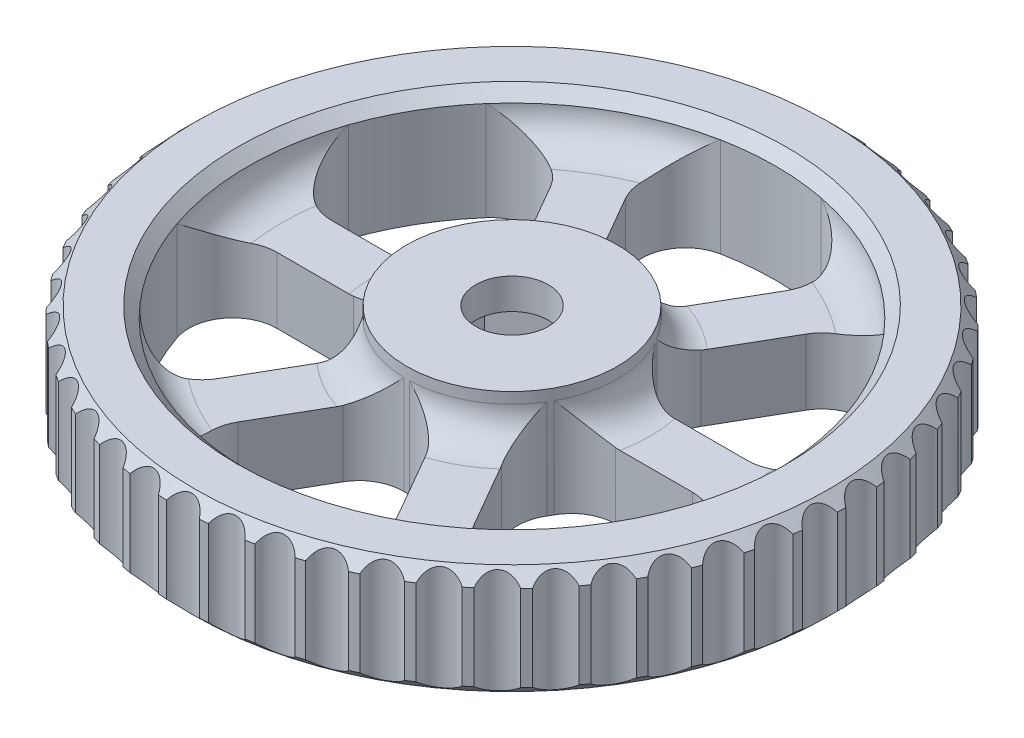
from build123d import *

# Parameters (mm, degrees)
SKETCH1_R           = 15
BOSS_EXTRUDE1_DEPTH = 5
CUT_EXTRUDE1_DEPTH  = 3.6
SKETCH3_R           = 1.65
CUT_EXTRUDE2_DEPTH  = 22.794494718
SKETCH6_R           = 12
SKETCH6_R_2         = 4.793642387
CUT_EXTRUDE5_DEPTH  = 2
CUT_EXTRUDE6_DEPTH  = 22.424285286
CUT_EXTRUDE7_DEPTH  = 22.794494718
FILLET1_START       = 3
FILLET1_DEPTH       = 1.5000001


with BuildPart() as part:
    # Sketch1 → Boss-Extrude1 (new body)
    with BuildSketch(Plane(origin=(0, 0, 0), x_dir=(1, 0, 0), z_dir=(0, 1, 0))):
        with Locations(Location((0, 0, 0), (0, 0, 270))):
            Circle(SKETCH1_R)
    extrude(amount=BOSS_EXTRUDE1_DEPTH)

    # Sketch2 → Cut-Extrude1 (cut)
    with BuildSketch(Plane.XZ):
        Polygon((2.95, 1.703183294), (0, 3.406366588), (-2.95, 1.703183294), (-2.95, -1.703183294), (0, -3.406366588), (2.95, -1.703183294), align=None)
    extrude(amount=-CUT_EXTRUDE1_DEPTH, mode=Mode.SUBTRACT)

    # Sketch3 → Cut-Extrude2 (cut, through all)
    with BuildSketch(Plane.XZ):
        with Locations(Location((0, 0, 0), (0, 0, 270))):
            Circle(SKETCH3_R)
    extrude(amount=-CUT_EXTRUDE2_DEPTH, mode=Mode.SUBTRACT)

    # Sketch6 → Cut-Extrude5 (cut)
    with BuildSketch(Plane(origin=(0, 5, 0), x_dir=(1, 0, 0), z_dir=(0, 1, 0))):
        with Locations(Location((0, 0, 0), (0, 0, 270))):
            Circle(SKETCH6_R)
        with Locations(Location((0, 0, 0), (0, 0, 270))):
            Circle(SKETCH6_R_2, mode=Mode.SUBTRACT)
    extrude(amount=-CUT_EXTRUDE5_DEPTH, mode=Mode.SUBTRACT)

    # Sketch8 → Cut-Extrude6 (cut, through all)
    with BuildSketch(Plane(origin=(0, 3, 0), x_dir=(1, 0, 0), z_dir=(0, 1, 0))):
        with BuildLine():
            Line((-4.06544463, 4.541556654), (-5.811101835, 7.565123625))
            ThreePointArc((-5.811101835, 7.565123625), (-7.350863082, 8.555858345), (-9.051783171, 7.878148351))
            ThreePointArc((-9.051783171, 7.878148351), (-10.392304845, 6), (-11.348568192, 3.9))
            ThreePointArc((-11.348568192, 3.9), (-11.085022219, 2.088104996), (-9.45714016, 1.25))
            Line((-9.45714016, 1.25), (-5.96582575, 1.25))
            ThreePointArc((-5.96582575, 1.25), (-4.944442808, 1.530471901), (-4.20952908, 2.293223115))
            ThreePointArc((-4.20952908, 2.293223115), (-4.151416084, 2.396821193), (-4.090754014, 2.498947564))
            ThreePointArc((-4.090754014, 2.498947564), (-3.797648949, 3.516777129), (-4.06544463, 4.541556654))
        make_face()
        with BuildLine():
            Line((-3.646038325, 8.815123625), (-1.90038112, 5.791556654))
            ThreePointArc((-1.90038112, 5.791556654), (-1.146793858, 5.047249029), (-0.118775066, 4.792170679))
            ThreePointArc((-0.118775066, 4.792170679), (0, 4.793642387), (0.118775066, 4.792170679))
            ThreePointArc((0.118775066, 4.792170679), (1.146793858, 5.047249029), (1.90038112, 5.791556654))
            Line((1.90038112, 5.791556654), (3.646038325, 8.815123625))
            ThreePointArc((3.646038325, 8.815123625), (3.734159137, 10.643963341), (2.296785021, 11.778148351))
            ThreePointArc((2.296785021, 11.778148351), (0, 12), (-2.296785021, 11.778148351))
            ThreePointArc((-2.296785021, 11.778148351), (-3.734159137, 10.643963341), (-3.646038325, 8.815123625))
        make_face()
        with BuildLine():
            Line((5.811101835, 7.565123625), (4.06544463, 4.541556654))
            ThreePointArc((4.06544463, 4.541556654), (3.797648949, 3.516777129), (4.090754014, 2.498947564))
            ThreePointArc((4.090754014, 2.498947564), (4.151416084, 2.396821193), (4.20952908, 2.293223115))
            ThreePointArc((4.20952908, 2.293223115), (4.944442808, 1.530471901), (5.96582575, 1.25))
            Line((5.96582575, 1.25), (9.45714016, 1.25))
            ThreePointArc((9.45714016, 1.25), (11.085022219, 2.088104996), (11.348568192, 3.9))
            ThreePointArc((11.348568192, 3.9), (10.392304845, 6), (9.051783171, 7.878148351))
            ThreePointArc((9.051783171, 7.878148351), (7.350863082, 8.555858345), (5.811101835, 7.565123625))
        make_face()
        with BuildLine():
            Line((9.45714016, -1.25), (5.96582575, -1.25))
            ThreePointArc((5.96582575, -1.25), (4.944442808, -1.530471901), (4.20952908, -2.293223115))
            ThreePointArc((4.20952908, -2.293223115), (4.151416084, -2.396821193), (4.090754014, -2.498947564))
            ThreePointArc((4.090754014, -2.498947564), (3.797648949, -3.516777129), (4.06544463, -4.541556654))
            Line((4.06544463, -4.541556654), (5.811101835, -7.565123625))
            ThreePointArc((5.811101835, -7.565123625), (7.350863082, -8.555858345), (9.051783171, -7.878148351))
            ThreePointArc((9.051783171, -7.878148351), (10.392304845, -6), (11.348568192, -3.9))
            ThreePointArc((11.348568192, -3.9), (11.085022219, -2.088104996), (9.45714016, -1.25))
        make_face()
        with BuildLine():
            Line((3.646038325, -8.815123625), (1.90038112, -5.791556654))
            ThreePointArc((1.90038112, -5.791556654), (1.146793858, -5.047249029), (0.118775066, -4.792170679))
            ThreePointArc((0.118775066, -4.792170679), (0, -4.793642387), (-0.118775066, -4.792170679))
            ThreePointArc((-0.118775066, -4.792170679), (-1.146793858, -5.047249029), (-1.90038112, -5.791556654))
            Line((-1.90038112, -5.791556654), (-3.646038325, -8.815123625))
            ThreePointArc((-3.646038325, -8.815123625), (-3.734159137, -10.643963341), (-2.296785021, -11.778148351))
            ThreePointArc((-2.296785021, -11.778148351), (0, -12), (2.296785021, -11.778148351))
            ThreePointArc((2.296785021, -11.778148351), (3.734159137, -10.643963341), (3.646038325, -8.815123625))
        make_face()
        with BuildLine():
            Line((-5.811101835, -7.565123625), (-4.06544463, -4.541556654))
            ThreePointArc((-4.06544463, -4.541556654), (-3.797648949, -3.516777129), (-4.090754014, -2.498947564))
            ThreePointArc((-4.090754014, -2.498947564), (-4.151416084, -2.396821193), (-4.20952908, -2.293223115))
            ThreePointArc((-4.20952908, -2.293223115), (-4.944442808, -1.530471901), (-5.96582575, -1.25))
            Line((-5.96582575, -1.25), (-9.45714016, -1.25))
            ThreePointArc((-9.45714016, -1.25), (-11.085022219, -2.088104996), (-11.348568192, -3.9))
            ThreePointArc((-11.348568192, -3.9), (-10.392304845, -6), (-9.051783171, -7.878148351))
            ThreePointArc((-9.051783171, -7.878148351), (-7.350863082, -8.555858345), (-5.811101835, -7.565123625))
        make_face()
    extrude(amount=-CUT_EXTRUDE6_DEPTH, mode=Mode.SUBTRACT)

    # Sketch4 → Cut-Extrude7 (cut, through all)
    with BuildSketch(Plane(origin=(0, 5, 0), x_dir=(1, 0, 0), z_dir=(0, 1, 0))):
        with BuildLine():
            ThreePointArc((-0.75, -14.981238267), (0, -14.563250232), (0.75, -14.981238267))
            ThreePointArc((0.75, -14.981238267), (0, -15), (-0.75, -14.981238267))
        make_face()
        with BuildLine():
            ThreePointArc((-2.621733061, -14.769106803), (-1.825259243, -14.448414655), (-1.133561009, -14.957106653))
            ThreePointArc((-1.133561009, -14.957106653), (-1.879998503, -14.88172052), (-2.621733061, -14.769106803))
        make_face()
        with BuildLine():
            ThreePointArc((-4.452119825, -14.324057702), (-3.621733057, -14.105718946), (-2.999245083, -14.697092533))
            ThreePointArc((-2.999245083, -14.697092533), (-3.730348307, -14.528747417), (-4.452119825, -14.324057702))
        make_face()
        with BuildLine():
            ThreePointArc((-6.212294, -13.653109655), (-5.361089977, -13.540567624), (-4.817629271, -14.205296484))
            ThreePointArc((-4.817629271, -14.205296484), (-5.52186829, -13.946647288), (-6.212294, -13.653109655))
        make_face()
        with BuildLine():
            ThreePointArc((-7.874496588, -12.766843913), (-7.015899306, -12.761873462), (-6.560036567, -13.489474424))
            ThreePointArc((-6.560036567, -13.489474424), (-7.226305112, -13.144600201), (-7.874496588, -12.766843913))
        make_face()
        with BuildLine():
            ThreePointArc((-9.41251366, -11.679237415), (-8.560063712, -11.781916931), (-8.198988168, -12.560915294))
            ThreePointArc((-8.198988168, -12.560915294), (-8.816778784, -12.135254916), (-9.41251366, -11.679237415))
        make_face()
        with BuildLine():
            ThreePointArc((-10.802089769, -10.407442367), (-9.9692308, -10.616152533), (-9.708636828, -11.434263026))
            ThreePointArc((-9.708636828, -11.434263026), (-10.268206589, -10.934529411), (-10.802089769, -10.407442367))
        make_face()
        with BuildLine():
            ThreePointArc((-12.02131047, -8.971515735), (-11.221177162, -9.282965067), (-11.065174485, -10.127285599))
            ThreePointArc((-11.065174485, -10.127285599), (-11.557698642, -9.561359846), (-12.02131047, -8.971515735))
        make_face()
        with BuildLine():
            ThreePointArc((-13.050947923, -7.394102941), (-12.296158857, -7.803379697), (-12.247207731, -8.660594829))
            ThreePointArc((-12.247207731, -8.660594829), (-12.664918883, -8.037401925), (-13.050947923, -7.394102941))
        make_face()
        with BuildLine():
            ThreePointArc((-13.874764132, -5.700080727), (-13.177222782, -6.200730367), (-13.236095194, -7.057321305))
            ThreePointArc((-13.236095194, -7.057321305), (-13.572405787, -6.386689373), (-13.874764132, -5.700080727))
        make_face()
        with BuildLine():
            ThreePointArc((-14.479767021, -3.916164834), (-13.850474032, -4.500291815), (-14.01624153, -5.342749608))
            ThreePointArc((-14.01624153, -5.342749608), (-14.265847744, -4.635254916), (-14.479767021, -3.916164834))
        make_face()
        with BuildLine():
            ThreePointArc((-14.856415335, -2.070488682), (-14.305295033, -2.728880973), (-14.575343363, -3.543919559))
            ThreePointArc((-14.575343363, -3.543919559), (-14.734308761, -2.810719719), (-14.856415335, -2.070488682))
        make_face()
        with BuildLine():
            ThreePointArc((-14.998769105, -0.192159688), (-14.534512985, -0.914434048), (-14.904583325, -1.68919978))
            ThreePointArc((-14.904583325, -1.68919978), (-14.970400926, -0.941857793), (-14.998769105, -0.192159688))
        make_face()
        with BuildLine():
            ThreePointArc((-14.904583325, 1.68919978), (-14.534512985, 0.914434048), (-14.998769105, 0.192159688))
            ThreePointArc((-14.998769105, 0.192159688), (-14.970400926, 0.941857793), (-14.904583325, 1.68919978))
        make_face()
        with BuildLine():
            ThreePointArc((-14.575343363, 3.543919559), (-14.305295033, 2.728880973), (-14.856415335, 2.070488682))
            ThreePointArc((-14.856415335, 2.070488682), (-14.734308761, 2.810719719), (-14.575343363, 3.543919559))
        make_face()
        with BuildLine():
            ThreePointArc((-14.01624153, 5.342749608), (-13.850474032, 4.500291815), (-14.479767021, 3.916164834))
            ThreePointArc((-14.479767021, 3.916164834), (-14.265847744, 4.635254916), (-14.01624153, 5.342749608))
        make_face()
        with BuildLine():
            ThreePointArc((-13.236095194, 7.057321305), (-13.177222782, 6.200730367), (-13.874764132, 5.700080727))
            ThreePointArc((-13.874764132, 5.700080727), (-13.572405787, 6.386689373), (-13.236095194, 7.057321305))
        make_face()
        with BuildLine():
            ThreePointArc((-12.247207731, 8.660594829), (-12.296158857, 7.803379697), (-13.050947923, 7.394102941))
            ThreePointArc((-13.050947923, 7.394102941), (-12.664918883, 8.037401925), (-12.247207731, 8.660594829))
        make_face()
        with BuildLine():
            ThreePointArc((-11.065174485, 10.127285599), (-11.221177162, 9.282965067), (-12.02131047, 8.971515735))
            ThreePointArc((-12.02131047, 8.971515735), (-11.557698642, 9.561359846), (-11.065174485, 10.127285599))
        make_face()
        with BuildLine():
            ThreePointArc((-9.708636828, 11.434263026), (-9.9692308, 10.616152533), (-10.802089769, 10.407442367))
            ThreePointArc((-10.802089769, 10.407442367), (-10.268206589, 10.934529411), (-9.708636828, 11.434263026))
        make_face()
        with BuildLine():
            ThreePointArc((-8.198988168, 12.560915294), (-8.560063712, 11.781916931), (-9.41251366, 11.679237415))
            ThreePointArc((-9.41251366, 11.679237415), (-8.816778784, 12.135254916), (-8.198988168, 12.560915294))
        make_face()
        with BuildLine():
            ThreePointArc((-6.560036567, 13.489474424), (-7.015899306, 12.761873462), (-7.874496588, 12.766843913))
            ThreePointArc((-7.874496588, 12.766843913), (-7.226305112, 13.144600201), (-6.560036567, 13.489474424))
        make_face()
        with BuildLine():
            ThreePointArc((-4.817629271, 14.205296484), (-5.361089977, 13.540567624), (-6.212294, 13.653109655))
            ThreePointArc((-6.212294, 13.653109655), (-5.52186829, 13.946647288), (-4.817629271, 14.205296484))
        make_face()
        with BuildLine():
            ThreePointArc((-2.999245083, 14.697092533), (-3.621733057, 14.105718946), (-4.452119825, 14.324057702))
            ThreePointArc((-4.452119825, 14.324057702), (-3.730348307, 14.528747417), (-2.999245083, 14.697092533))
        make_face()
        with BuildLine():
            ThreePointArc((-1.133561009, 14.957106653), (-1.825259243, 14.448414655), (-2.621733061, 14.769106803))
            ThreePointArc((-2.621733061, 14.769106803), (-1.879998503, 14.88172052), (-1.133561009, 14.957106653))
        make_face()
        with BuildLine():
            ThreePointArc((0.75, 14.981238267), (0, 14.563250232), (-0.75, 14.981238267))
            ThreePointArc((-0.75, 14.981238267), (0, 15), (0.75, 14.981238267))
        make_face()
        with BuildLine():
            ThreePointArc((2.621733061, 14.769106803), (1.825259243, 14.448414655), (1.133561009, 14.957106653))
            ThreePointArc((1.133561009, 14.957106653), (1.879998503, 14.88172052), (2.621733061, 14.769106803))
        make_face()
        with BuildLine():
            ThreePointArc((4.452119825, 14.324057702), (3.621733057, 14.105718946), (2.999245083, 14.697092533))
            ThreePointArc((2.999245083, 14.697092533), (3.730348307, 14.528747417), (4.452119825, 14.324057702))
        make_face()
        with BuildLine():
            ThreePointArc((6.212294, 13.653109655), (5.361089977, 13.540567624), (4.817629271, 14.205296484))
            ThreePointArc((4.817629271, 14.205296484), (5.52186829, 13.946647288), (6.212294, 13.653109655))
        make_face()
        with BuildLine():
            ThreePointArc((7.874496588, 12.766843913), (7.015899306, 12.761873462), (6.560036567, 13.489474424))
            ThreePointArc((6.560036567, 13.489474424), (7.226305112, 13.144600201), (7.874496588, 12.766843913))
        make_face()
        with BuildLine():
            ThreePointArc((9.41251366, 11.679237415), (8.560063712, 11.781916931), (8.198988168, 12.560915294))
            ThreePointArc((8.198988168, 12.560915294), (8.816778784, 12.135254916), (9.41251366, 11.679237415))
        make_face()
        with BuildLine():
            ThreePointArc((10.802089769, 10.407442367), (9.9692308, 10.616152533), (9.708636828, 11.434263026))
            ThreePointArc((9.708636828, 11.434263026), (10.268206589, 10.934529411), (10.802089769, 10.407442367))
        make_face()
        with BuildLine():
            ThreePointArc((12.02131047, 8.971515735), (11.221177162, 9.282965067), (11.065174485, 10.127285599))
            ThreePointArc((11.065174485, 10.127285599), (11.557698642, 9.561359846), (12.02131047, 8.971515735))
        make_face()
        with BuildLine():
            ThreePointArc((13.050947923, 7.394102941), (12.296158857, 7.803379697), (12.247207731, 8.660594829))
            ThreePointArc((12.247207731, 8.660594829), (12.664918883, 8.037401925), (13.050947923, 7.394102941))
        make_face()
        with BuildLine():
            ThreePointArc((13.874764132, 5.700080727), (13.177222782, 6.200730367), (13.236095194, 7.057321305))
            ThreePointArc((13.236095194, 7.057321305), (13.572405787, 6.386689373), (13.874764132, 5.700080727))
        make_face()
        with BuildLine():
            ThreePointArc((14.479767021, 3.916164834), (13.850474032, 4.500291815), (14.01624153, 5.342749608))
            ThreePointArc((14.01624153, 5.342749608), (14.265847744, 4.635254916), (14.479767021, 3.916164834))
        make_face()
        with BuildLine():
            ThreePointArc((14.856415335, 2.070488682), (14.305295033, 2.728880973), (14.575343363, 3.543919559))
            ThreePointArc((14.575343363, 3.543919559), (14.734308761, 2.810719719), (14.856415335, 2.070488682))
        make_face()
        with BuildLine():
            ThreePointArc((14.998769105, 0.192159688), (14.534512985, 0.914434048), (14.904583325, 1.68919978))
            ThreePointArc((14.904583325, 1.68919978), (14.970400926, 0.941857793), (14.998769105, 0.192159688))
        make_face()
        with BuildLine():
            ThreePointArc((14.904583325, -1.68919978), (14.534512985, -0.914434048), (14.998769105, -0.192159688))
            ThreePointArc((14.998769105, -0.192159688), (14.970400926, -0.941857793), (14.904583325, -1.68919978))
        make_face()
        with BuildLine():
            ThreePointArc((14.575343363, -3.543919559), (14.305295033, -2.728880973), (14.856415335, -2.070488682))
            ThreePointArc((14.856415335, -2.070488682), (14.734308761, -2.810719719), (14.575343363, -3.543919559))
        make_face()
        with BuildLine():
            ThreePointArc((14.01624153, -5.342749608), (13.850474032, -4.500291815), (14.479767021, -3.916164834))
            ThreePointArc((14.479767021, -3.916164834), (14.265847744, -4.635254916), (14.01624153, -5.342749608))
        make_face()
        with BuildLine():
            ThreePointArc((13.236095194, -7.057321305), (13.177222782, -6.200730367), (13.874764132, -5.700080727))
            ThreePointArc((13.874764132, -5.700080727), (13.572405787, -6.386689373), (13.236095194, -7.057321305))
        make_face()
        with BuildLine():
            ThreePointArc((12.247207731, -8.660594829), (12.296158857, -7.803379697), (13.050947923, -7.394102941))
            ThreePointArc((13.050947923, -7.394102941), (12.664918883, -8.037401925), (12.247207731, -8.660594829))
        make_face()
        with BuildLine():
            ThreePointArc((11.065174485, -10.127285599), (11.221177162, -9.282965067), (12.02131047, -8.971515735))
            ThreePointArc((12.02131047, -8.971515735), (11.557698642, -9.561359846), (11.065174485, -10.127285599))
        make_face()
        with BuildLine():
            ThreePointArc((9.708636828, -11.434263026), (9.9692308, -10.616152533), (10.802089769, -10.407442367))
            ThreePointArc((10.802089769, -10.407442367), (10.268206589, -10.934529411), (9.708636828, -11.434263026))
        make_face()
        with BuildLine():
            ThreePointArc((8.198988168, -12.560915294), (8.560063712, -11.781916931), (9.41251366, -11.679237415))
            ThreePointArc((9.41251366, -11.679237415), (8.816778784, -12.135254916), (8.198988168, -12.560915294))
        make_face()
        with BuildLine():
            ThreePointArc((6.560036567, -13.489474424), (7.015899306, -12.761873462), (7.874496588, -12.766843913))
            ThreePointArc((7.874496588, -12.766843913), (7.226305112, -13.144600201), (6.560036567, -13.489474424))
        make_face()
        with BuildLine():
            ThreePointArc((4.817629271, -14.205296484), (5.361089977, -13.540567624), (6.212294, -13.653109655))
            ThreePointArc((6.212294, -13.653109655), (5.52186829, -13.946647288), (4.817629271, -14.205296484))
        make_face()
        with BuildLine():
            ThreePointArc((2.999245083, -14.697092533), (3.621733057, -14.105718946), (4.452119825, -14.324057702))
            ThreePointArc((4.452119825, -14.324057702), (3.730348307, -14.528747417), (2.999245083, -14.697092533))
        make_face()
        with BuildLine():
            ThreePointArc((1.133561009, -14.957106653), (1.825259243, -14.448414655), (2.621733061, -14.769106803))
            ThreePointArc((2.621733061, -14.769106803), (1.879998503, -14.88172052), (1.133561009, -14.957106653))
        make_face()
    extrude(amount=-CUT_EXTRUDE7_DEPTH, mode=Mode.SUBTRACT)

    # Sketch5 → Cut-Revolve1 (revolve, cut)
    with BuildSketch(Plane.XY, mode=Mode.PRIVATE) as cut_revolve1_sk:
        Polygon((14.35, 5.1), (15.1, 4.35), (15.1, 5.1), align=None)
        Polygon((15.1, -0.1), (14.35, -0.1), (15.1, 0.65), align=None)
    revolve(cut_revolve1_sk.sketch.rotate(Axis((0, 0, 0), (0, 1, 0)), 270), axis=Axis((0, 0, 0), (0, 1, 0)), mode=Mode.SUBTRACT)

    # Fillet1: read off the stored shape, not the designer's step
    # Fillet1 outline → Fillet1 (add)
    with BuildSketch(Plane(origin=(0, 0, 0), x_dir=(1, 0, 0), z_dir=(0, 1, 0)).offset(FILLET1_START)):
        with BuildLine():
            ThreePointArc((-9.051783171, 7.878148351), (-7.350863082, 8.555858345), (-5.811101835, 7.565123625))
            Line((-5.811101835, 7.565123625), (-4.06544463, 4.541556654))
            ThreePointArc((-4.06544463, 4.541556654), (-3.797648949, 3.516777129), (-4.090754014, 2.498947564))
            ThreePointArc((-4.090754014, 2.498947564), (-2.396821193, 4.151416084), (-0.118775066, 4.792170679))
            ThreePointArc((-0.118775066, 4.792170679), (-1.146793858, 5.047249029), (-1.90038112, 5.791556654))
            Line((-1.90038112, 5.791556654), (-3.646038325, 8.815123625))
            ThreePointArc((-3.646038325, 8.815123625), (-3.734159137, 10.643963341), (-2.296785021, 11.778148351))
            ThreePointArc((-2.296785021, 11.778148351), (-6, 10.392304845), (-9.051783171, 7.878148351))
        make_face()
        with BuildLine():
            ThreePointArc((-9.45714016, 1.25), (-11.085022219, 2.088104996), (-11.348568192, 3.9))
            ThreePointArc((-11.348568192, 3.9), (-12, 0), (-11.348568192, -3.9))
            ThreePointArc((-11.348568192, -3.9), (-11.085022219, -2.088104996), (-9.45714016, -1.25))
            Line((-9.45714016, -1.25), (-5.96582575, -1.25))
            ThreePointArc((-5.96582575, -1.25), (-4.944442808, -1.530471901), (-4.20952908, -2.293223115))
            ThreePointArc((-4.20952908, -2.293223115), (-4.793642387, 0), (-4.20952908, 2.293223115))
            ThreePointArc((-4.20952908, 2.293223115), (-4.944442808, 1.530471901), (-5.96582575, 1.25))
            Line((-5.96582575, 1.25), (-9.45714016, 1.25))
        make_face()
        with BuildLine():
            ThreePointArc((9.051783171, 7.878148351), (6, 10.392304845), (2.296785021, 11.778148351))
            ThreePointArc((2.296785021, 11.778148351), (3.734159137, 10.643963341), (3.646038325, 8.815123625))
            Line((3.646038325, 8.815123625), (1.90038112, 5.791556654))
            ThreePointArc((1.90038112, 5.791556654), (1.146793858, 5.047249029), (0.118775066, 4.792170679))
            ThreePointArc((0.118775066, 4.792170679), (2.396821193, 4.151416084), (4.090754014, 2.498947564))
            ThreePointArc((4.090754014, 2.498947564), (3.797648949, 3.516777129), (4.06544463, 4.541556654))
            Line((4.06544463, 4.541556654), (5.811101835, 7.565123625))
            ThreePointArc((5.811101835, 7.565123625), (7.350863082, 8.555858345), (9.051783171, 7.878148351))
        make_face()
        with BuildLine():
            ThreePointArc((-5.811101835, -7.565123625), (-7.350863082, -8.555858345), (-9.051783171, -7.878148351))
            ThreePointArc((-9.051783171, -7.878148351), (-6, -10.392304845), (-2.296785021, -11.778148351))
            ThreePointArc((-2.296785021, -11.778148351), (-3.734159137, -10.643963341), (-3.646038325, -8.815123625))
            Line((-3.646038325, -8.815123625), (-1.90038112, -5.791556654))
            ThreePointArc((-1.90038112, -5.791556654), (-1.146793858, -5.047249029), (-0.118775066, -4.792170679))
            ThreePointArc((-0.118775066, -4.792170679), (-2.396821193, -4.151416084), (-4.090754014, -2.498947564))
            ThreePointArc((-4.090754014, -2.498947564), (-3.797648949, -3.516777129), (-4.06544463, -4.541556654))
            Line((-4.06544463, -4.541556654), (-5.811101835, -7.565123625))
        make_face()
        with BuildLine():
            ThreePointArc((11.348568192, -3.9), (12, 0), (11.348568192, 3.9))
            ThreePointArc((11.348568192, 3.9), (11.085022219, 2.088104996), (9.45714016, 1.25))
            Line((9.45714016, 1.25), (5.96582575, 1.25))
            ThreePointArc((5.96582575, 1.25), (4.944442808, 1.530471901), (4.20952908, 2.293223115))
            ThreePointArc((4.20952908, 2.293223115), (4.793642387, 0), (4.20952908, -2.293223115))
            ThreePointArc((4.20952908, -2.293223115), (4.944442808, -1.530471901), (5.96582575, -1.25))
            Line((5.96582575, -1.25), (9.45714016, -1.25))
            ThreePointArc((9.45714016, -1.25), (11.085022219, -2.088104996), (11.348568192, -3.9))
        make_face()
        with BuildLine():
            ThreePointArc((3.646038325, -8.815123625), (3.734159137, -10.643963341), (2.296785021, -11.778148351))
            ThreePointArc((2.296785021, -11.778148351), (6, -10.392304845), (9.051783171, -7.878148351))
            ThreePointArc((9.051783171, -7.878148351), (7.350863082, -8.555858345), (5.811101835, -7.565123625))
            Line((5.811101835, -7.565123625), (4.06544463, -4.541556654))
            ThreePointArc((4.06544463, -4.541556654), (3.797648949, -3.516777129), (4.090754014, -2.498947564))
            ThreePointArc((4.090754014, -2.498947564), (2.396821193, -4.151416084), (0.118775066, -4.792170679))
            ThreePointArc((0.118775066, -4.792170679), (1.146793858, -5.047249029), (1.90038112, -5.791556654))
            Line((1.90038112, -5.791556654), (3.646038325, -8.815123625))
        make_face()
    extrude(amount=FILLET1_DEPTH)

    # Fillet1 2 outline → Fillet1 2 (revolve, cut)
    with BuildSketch(Plane.XY):
        with BuildLine():
            ThreePointArc((4.793642387, 4.5), (5.232982215, 3.439339828), (6.293642387, 3))
            Line((6.293642387, 3), (10.5, 3))
            ThreePointArc((10.5, 3), (11.560660172, 3.439339828), (12, 4.5))
            Line((12, 4.5), (4.793642387, 4.5))
        make_face()
    revolve(axis=Axis((0, 0, 0), (0, 1, 0)), mode=Mode.SUBTRACT)

    # Chamfer1: read off the stored shape, not the designer's step
    # Chamfer1 outline → Chamfer1 (revolve, cut)
    with BuildSketch(Plane.XY):
        Polygon((12, 5), (12, 4.5), (12.5, 5), align=None)
    revolve(axis=Axis((0, 0, 0), (0, 1, 0)), mode=Mode.SUBTRACT)


solid = part.part
